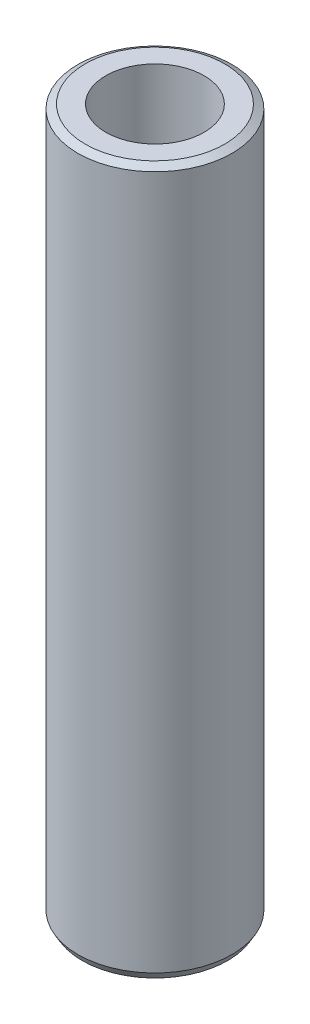
from build123d import *
from OCP.BRepFilletAPI import BRepFilletAPI_MakeChamfer

# Parameters (mm, degrees)
SKETCH1_R           = 50
BOSS_EXTRUDE1_DEPTH = 457.799383789
SKETCH2_R           = 31.87185323
CUT_EXTRUDE1_DEPTH  = 464.22810342
CHAMFER1_SIZE       = 2.762358898
CHAMFER1_SIZE2      = 4.784545959


with BuildPart() as part:
    # Sketch1 → Boss-Extrude1 (new body)
    with BuildSketch(Plane(origin=(0, 0, 0), x_dir=(1, 0, 0), z_dir=(0, 1, 0))):
        Circle(SKETCH1_R)
    extrude(amount=BOSS_EXTRUDE1_DEPTH)

    # Sketch2 → Cut-Extrude1 (cut, through all)
    with BuildSketch(Plane(origin=(0, 0, 0), x_dir=(1, 0, 0), z_dir=(0, 1, 0))):
        Circle(SKETCH2_R)
    extrude(amount=CUT_EXTRUDE1_DEPTH, mode=Mode.SUBTRACT)

    # Chamfer1: one chamfer whose edges measure the first distance from different faces: ONE call of the kernel's chamfer builder (chamfer() names one face for all edges)
    chamfer1_edges_1 = [part.edges().sort_by_distance(p)[0] for p in [
        (-50, 457.799383789, 0),
    ]]
    chamfer1_side_1 = [part.faces().sort_by_distance(p)[0] for p in [
        (-50, 228.899691895, 0),
    ]]
    chamfer1_edges_2 = [part.edges().sort_by_distance(p)[0] for p in [
        (-50, 0, 0),
    ]]
    chamfer1_side_2 = [part.faces().sort_by_distance(p)[0] for p in [
        (-48.585786438, 0, 0),
    ]]
    chamfer1 = BRepFilletAPI_MakeChamfer(part.part.solid().wrapped)
    for e in chamfer1_edges_1:
        chamfer1.Add(CHAMFER1_SIZE, CHAMFER1_SIZE2, e.wrapped, chamfer1_side_1[0].wrapped)  # the first distance lies on this face
    for e in chamfer1_edges_2:
        chamfer1.Add(CHAMFER1_SIZE, CHAMFER1_SIZE2, e.wrapped, chamfer1_side_2[0].wrapped)  # the first distance lies on this face
    add(Compound.cast(chamfer1.Shape()), mode=Mode.REPLACE)


solid = part.part
